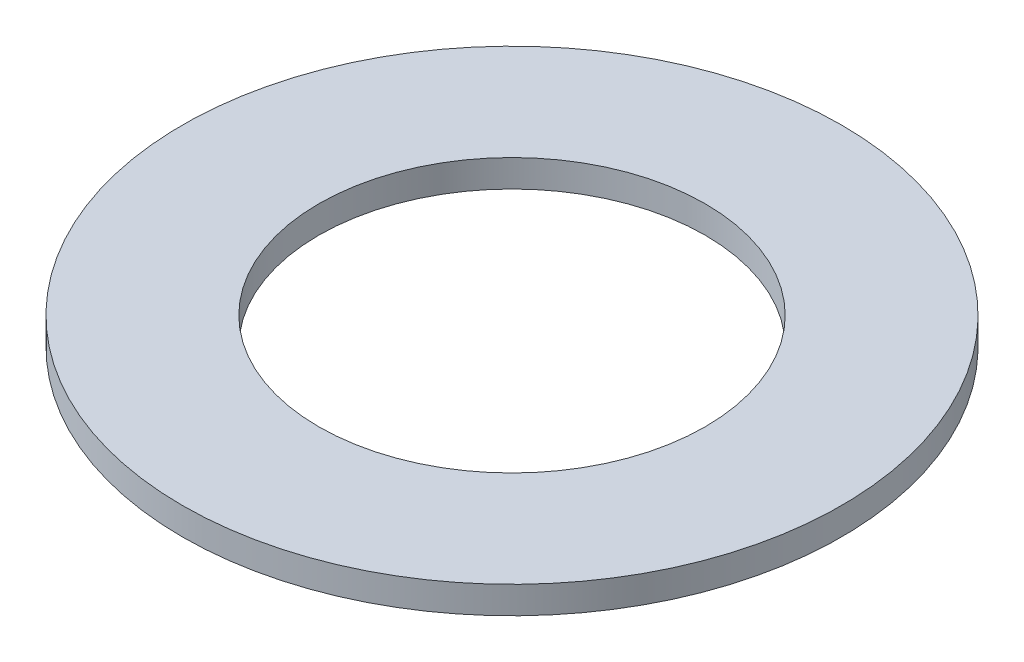
from build123d import *

# Parameters (mm, degrees)
SKETCH1_R           = 72.5
BOSS_EXTRUDE1_DEPTH = 6
SKETCH2_R           = 42.5
CUT_EXTRUDE1_DEPTH  = 103.705890776


with BuildPart() as part:
    # Sketch1 → Boss-Extrude1 (new body)
    with BuildSketch(Plane(origin=(0, 0, 0), x_dir=(1, 0, 0), z_dir=(0, 1, 0))):
        Circle(SKETCH1_R)
    extrude(amount=BOSS_EXTRUDE1_DEPTH)

    # Sketch2 → Cut-Extrude1 (cut, through all)
    with BuildSketch(Plane(origin=(0, 0, 0), x_dir=(1, 0, 0), z_dir=(0, 1, 0))):
        Circle(SKETCH2_R)
    extrude(amount=CUT_EXTRUDE1_DEPTH, mode=Mode.SUBTRACT)


solid = part.part
